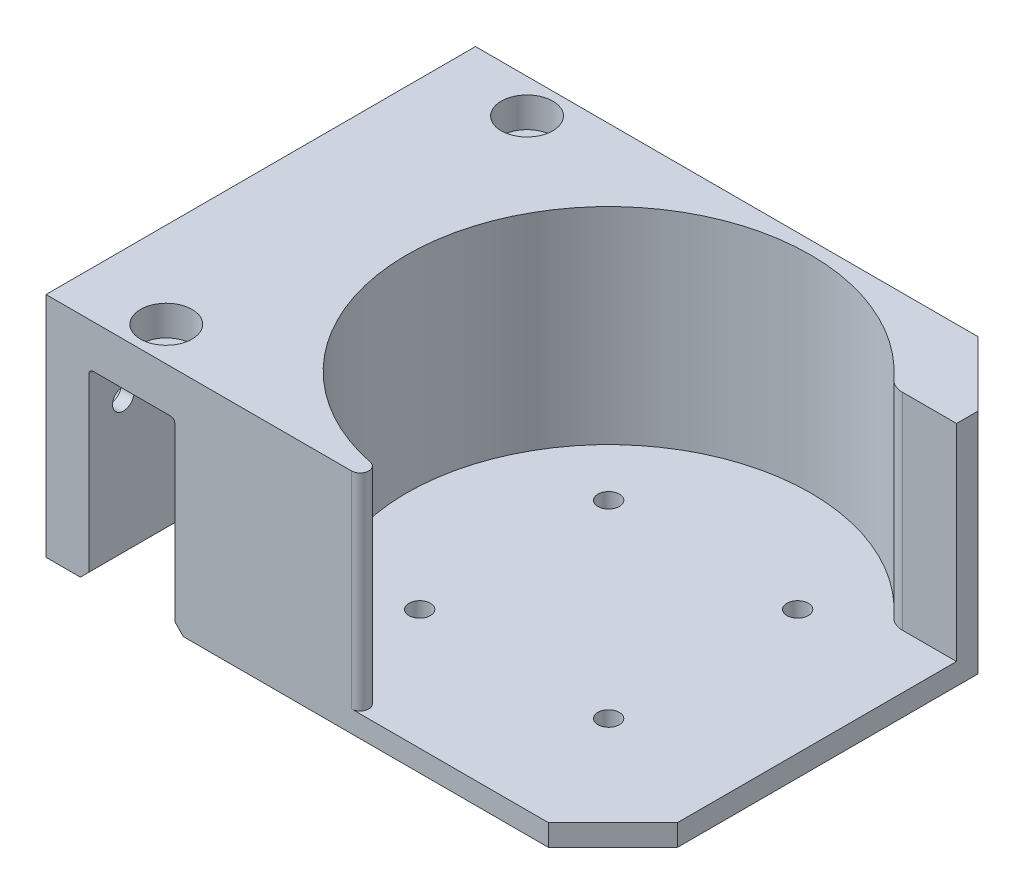
from build123d import *

# Parameters (mm, degrees)
SKETCH_1_W          = 102
SKETCH_1_H          = 100
EXTRUDE_1_DEPTH     = 53
CUT_EXTRUDE_1_DEPTH = 48
SKETCH_3_W          = 51
SKETCH_3_H          = 50
CUT_EXTRUDE_2_DEPTH = 48
CUT_EXTRUDE_3_DEPTH = 48
CHAMFER_1_SIZE      = 15
FILLET_2_R          = 5
SKETCH_5_W          = 100
SKETCH_5_H          = 10
EXTRUDE_2_DEPTH     = 30
SKETCH_6_W          = 10
SKETCH_6_H          = 100
EXTRUDE_3_DEPTH     = 43
FILLET_START        = 5
FILLET_5_DEPTH      = 49
SKETCH_8_R          = 2.5
CUT_EXTRUDE_4_DEPTH = 30
SKETCH_9_R          = 6
CUT_EXTRUDE_5_DEPTH = 7
SKETCH_10_R         = 2.5
CUT_EXTRUDE_6_DEPTH = 30
SKETCH_11_R         = 6
CUT_EXTRUDE_7_DEPTH = 7
CHAMFER_2_SIZE      = 2
FILLET_7_R          = 1


with BuildPart() as part:
    # 草图1 → 凸台-拉伸1 (new body)
    with BuildSketch(Plane(origin=(0, 0, 0), x_dir=(1, 0, 0), z_dir=(0, 1, 0))):
        Rectangle(SKETCH_1_W, SKETCH_1_H)
    extrude(amount=EXTRUDE_1_DEPTH)

    # 草图2 → 切除-拉伸1 (cut)
    with BuildSketch(Plane(origin=(0, 53, 0), x_dir=(1, 0, 0), z_dir=(0, 1, 0))):
        with BuildLine():
            Line((23, -30), (23, 30))
            Line((23, 30), (36.18010503, 30))
            ThreePointArc((36.18010503, 30), (-47, 0), (36.18010503, -30))
            Line((36.18010503, -30), (23, -30))
        make_face()
        with BuildLine():
            Line((36.18010503, 30), (23, 30))
            Line((23, 30), (23, -30))
            Line((23, -30), (36.18010503, -30))
            ThreePointArc((36.18010503, -30), (44.21235651, -15.94576846), (47, 0))
            ThreePointArc((47, 0), (44.21235651, 15.94576846), (36.18010503, 30))
        make_face()
        with BuildLine():
            Line((51, 30), (36.18010503, 30))
            ThreePointArc((36.18010503, 30), (44.21235651, 15.94576846), (47, 0))
            ThreePointArc((47, 0), (44.21235651, -15.94576846), (36.18010503, -30))
            Line((36.18010503, -30), (51, -30))
            Line((51, -30), (51, 30))
        make_face()
    extrude(amount=-CUT_EXTRUDE_1_DEPTH, mode=Mode.SUBTRACT)

    # 草图3 → 切除-拉伸2 (cut)
    with BuildSketch(Plane(origin=(0, 53, 0), x_dir=(1, 0, 0), z_dir=(0, 1, 0))):
        with Locations((25.5, -25)):
            Rectangle(SKETCH_3_W, SKETCH_3_H)
    extrude(amount=-CUT_EXTRUDE_2_DEPTH, mode=Mode.SUBTRACT)

    # 草图4 → 切除-拉伸3 (cut)
    with BuildSketch(Plane(origin=(0, 5, 0), x_dir=(1, 0, 0), z_dir=(0, 1, 0))):
        with BuildLine():
            ThreePointArc((24.5, 22), (22, 24.5), (19.5, 22))
            Line((19.5, 22), (22, 22))
            Line((22, 22), (22, 19.5))
            ThreePointArc((22, 19.5), (23.767766953, 20.232233047), (24.5, 22))
        make_face()
        with BuildLine():
            Line((22, 22), (19.5, 22))
            ThreePointArc((19.5, 22), (20.232233047, 20.232233047), (22, 19.5))
            Line((22, 19.5), (22, 22))
        make_face()
        with BuildLine():
            Line((-22, 19.5), (-22, 22))
            Line((-22, 22), (-19.5, 22))
            ThreePointArc((-19.5, 22), (-23.767766953, 23.767766953), (-22, 19.5))
        make_face()
        with BuildLine():
            Line((-19.5, 22), (-22, 22))
            Line((-22, 22), (-22, 19.5))
            ThreePointArc((-22, 19.5), (-20.232233047, 20.232233047), (-19.5, 22))
        make_face()
        with BuildLine():
            ThreePointArc((-19.5, -22), (-20.232233047, -20.232233047), (-22, -19.5))
            Line((-22, -19.5), (-22, -22))
            Line((-22, -22), (-19.5, -22))
        make_face()
        with BuildLine():
            Line((-22, -22), (-22, -19.5))
            ThreePointArc((-22, -19.5), (-23.767766953, -23.767766953), (-19.5, -22))
            Line((-19.5, -22), (-22, -22))
        make_face()
        with BuildLine():
            ThreePointArc((24.5, -22), (23.767766953, -20.232233047), (22, -19.5))
            Line((22, -19.5), (22, -22))
            Line((22, -22), (19.5, -22))
            ThreePointArc((19.5, -22), (22, -24.5), (24.5, -22))
        make_face()
        with BuildLine():
            Line((22, -22), (22, -19.5))
            ThreePointArc((22, -19.5), (20.232233047, -20.232233047), (19.5, -22))
            Line((19.5, -22), (22, -22))
        make_face()
    extrude(amount=-CUT_EXTRUDE_3_DEPTH, mode=Mode.SUBTRACT)

    # 倒角1
    chamfer_1_edges = [part.edges().sort_by_distance(p)[0] for p in [
        (51, 2.5, 50),
        (51, 26.5, -50),
    ]]
    chamfer(chamfer_1_edges, length=CHAMFER_1_SIZE)

    # 圆角2
    # the kernel refuses this fillet: 5 mm, written as the material it takes off along each edge
    with BuildSketch(Plane(origin=(0, 5, 47), x_dir=(-0.9989898744385596, 0, -0.0449358517136451), z_dir=(0, 1, 0))) as fillet_2_piece_1:
        with BuildLine():
            CenterArc((4.44864932, 4.994949372), FILLET_2_R, 203.55292178, 63.871576317)
            Line((-0.134807555, 2.996969623), (0, 0))
            ThreePointArc((0, 0), (2.111985031, 0.047475901), (4.223970061, 0))
        make_face()
    extrude(amount=58.559925153, mode=Mode.SUBTRACT)
    with BuildSketch(Plane(origin=(36.18010503, 58.69416004, -30), x_dir=(1, 0, 0), z_dir=(0, -1, 0))) as fillet_2_piece_2:
        with BuildLine():
            CenterArc((2.277664016, -5), FILLET_2_R, 90, 47.695010293)
            ThreePointArc((-1.420198392, -1.634615385), (-0.700684154, -0.825487738), (0, 0))
            Line((0, 0), (2.277664016, 0))
        make_face()
    extrude(amount=53.69416004, mode=Mode.SUBTRACT)

    # 草图5 → 凸台-拉伸2 (add)
    with BuildSketch(Plane.ZY.offset(51)):
        with Locations((0, 48)):
            Rectangle(SKETCH_5_W, SKETCH_5_H)
    extrude(amount=EXTRUDE_2_DEPTH)

    # 草图6 → 凸台-拉伸3 (add)
    with BuildSketch(Plane.XZ.offset(-43)):
        with Locations((-76, 0)):
            Rectangle(SKETCH_6_W, SKETCH_6_H)
    extrude(amount=EXTRUDE_3_DEPTH)

    # 圆角5: read off the stored shape, not the designer's step
    # 圆角5 outline → 圆角5 (cut)
    with BuildSketch(Plane(origin=(0, 0, 0), x_dir=(1, 0, 0), z_dir=(0, 1, 0)).offset(FILLET_START)):
        with BuildLine():
            ThreePointArc((-9.446863606, -46.040816327), (-7.859088048, -48.202030509), (-9.848857802, -50))
            Line((-9.848857802, -50), (0, -50))
            ThreePointArc((0, -50), (-1.653487381, -47.801385193), (-4.219703321, -46.810192308))
            ThreePointArc((-4.219703321, -46.810192308), (-6.844103136, -46.499013455), (-9.446863606, -46.040816327))
        make_face()
    extrude(amount=FILLET_5_DEPTH, mode=Mode.SUBTRACT)

    # 草图8 → 切除-拉伸4 (cut)
    with BuildSketch(Plane.XZ.offset(-43)):
        with Locations(Location((-61, 42, 0), (0, 0, 270))):
            Circle(SKETCH_8_R)
        with Locations(Location((-61, -42, 0), (0, 0, 270))):
            Circle(SKETCH_8_R)
    extrude(amount=-CUT_EXTRUDE_4_DEPTH, mode=Mode.SUBTRACT)

    # 草图9 → 切除-拉伸5 (cut)
    with BuildSketch(Plane(origin=(0, 53, 0), x_dir=(1, 0, 0), z_dir=(0, 1, 0))):
        with Locations(Location((-61, 42, 0), (0, 0, 270))):
            Circle(SKETCH_9_R)
        with Locations(Location((-61, -42, 0), (0, 0, 270))):
            Circle(SKETCH_9_R)
    extrude(amount=-CUT_EXTRUDE_5_DEPTH, mode=Mode.SUBTRACT)

    # 草图10 → 切除-拉伸6 (cut)
    with BuildSketch(Plane(origin=(-71, 0, 0), x_dir=(0, 0, -1), z_dir=(1, 0, 0))):
        with Locations((-42, 33)):
            Circle(SKETCH_10_R)
        with Locations((42, 33)):
            Circle(SKETCH_10_R)
    extrude(amount=-CUT_EXTRUDE_6_DEPTH, mode=Mode.SUBTRACT)

    # 草图11 → 切除-拉伸7 (cut)
    with BuildSketch(Plane.ZY.offset(81)):
        with Locations((-42, 33)):
            Circle(SKETCH_11_R)
        with Locations((42, 33)):
            Circle(SKETCH_11_R)
    extrude(amount=-CUT_EXTRUDE_7_DEPTH, mode=Mode.SUBTRACT)

    # 倒角2
    chamfer_2_edges = [part.edges().sort_by_distance(p)[0] for p in [
        (-71, 0, 0),
        (-51, 0, 0),
    ]]
    chamfer(chamfer_2_edges, length=CHAMFER_2_SIZE)

    # 圆角7
    fillet_7_edges = [part.edges().sort_by_distance(p)[0] for p in [
        (-51, 43, 0),
        (-71, 43, 0),
    ]]
    fillet(fillet_7_edges, radius=FILLET_7_R)


solid = part.part
